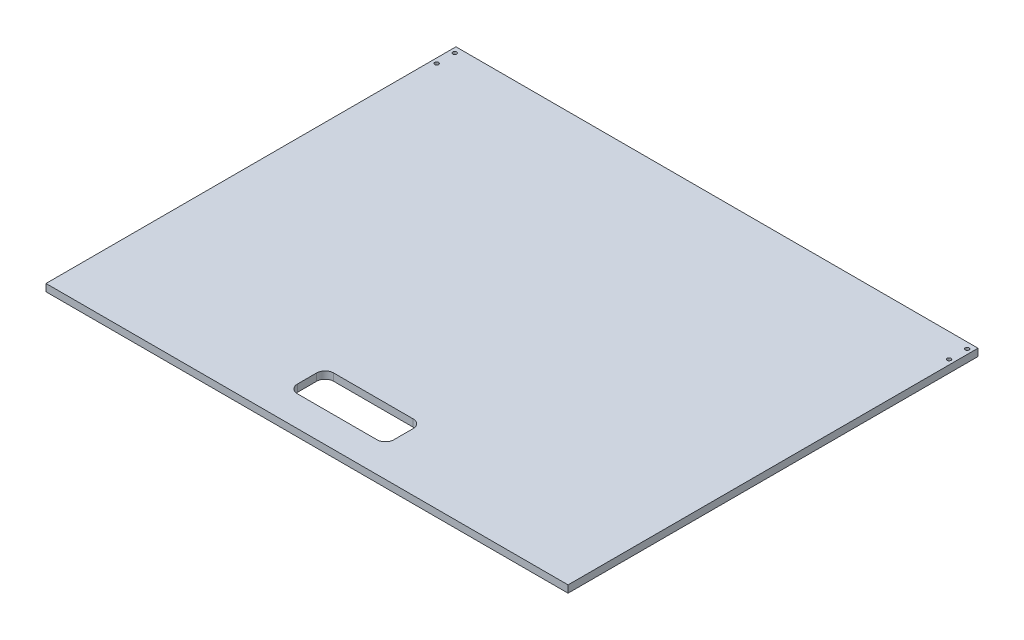
from build123d import *

# Parameters (mm, degrees)
SKETCH1_W           = 433
SKETCH1_H           = 340
BOSS_EXTRUDE1_DEPTH = 6
SKETCH2_R           = 1.6
CUT_EXTRUDE1_DEPTH  = 276.332980226
CUT_EXTRUDE2_DEPTH  = 276.332980226


with BuildPart() as part:
    # Sketch1 → Boss-Extrude1 (new body)
    with BuildSketch(Plane(origin=(0, 0, 0), x_dir=(1, 0, 0), z_dir=(0, 1, 0))):
        Rectangle(SKETCH1_W, SKETCH1_H)
    extrude(amount=BOSS_EXTRUDE1_DEPTH)

    # Sketch2 → Cut-Extrude1 (cut, through all)
    with BuildSketch(Plane.XZ):
        with Locations((212.5, -150)):
            Circle(SKETCH2_R)
        with Locations((212.5, -165)):
            Circle(SKETCH2_R)
    cut_extrude1 = extrude(amount=-CUT_EXTRUDE1_DEPTH, mode=Mode.SUBTRACT)

    # Mirror1: Cut-Extrude1 across plane
    add(cut_extrude1.mirror(Plane(origin=(0, 0, 0), x_dir=(0, 0, 1), z_dir=(1, 0, 0))), mode=Mode.SUBTRACT)

    # Sketch3 → Cut-Extrude2 (cut, through all)
    with BuildSketch(Plane(origin=(0, 6, 0), x_dir=(1, 0, 0), z_dir=(0, 1, 0))):
        with BuildLine():
            Line((-33, -145), (33, -145))
            ThreePointArc((33, -145), (37.949747468, -142.949747468), (40, -138))
            Line((40, -138), (40, -122))
            ThreePointArc((40, -122), (37.949747468, -117.050252532), (33, -115))
            Line((33, -115), (-33, -115))
            ThreePointArc((-33, -115), (-37.949747468, -117.050252532), (-40, -122))
            Line((-40, -122), (-40, -138))
            ThreePointArc((-40, -138), (-37.949747468, -142.949747468), (-33, -145))
        make_face()
    extrude(amount=-CUT_EXTRUDE2_DEPTH, mode=Mode.SUBTRACT)


solid = part.part
